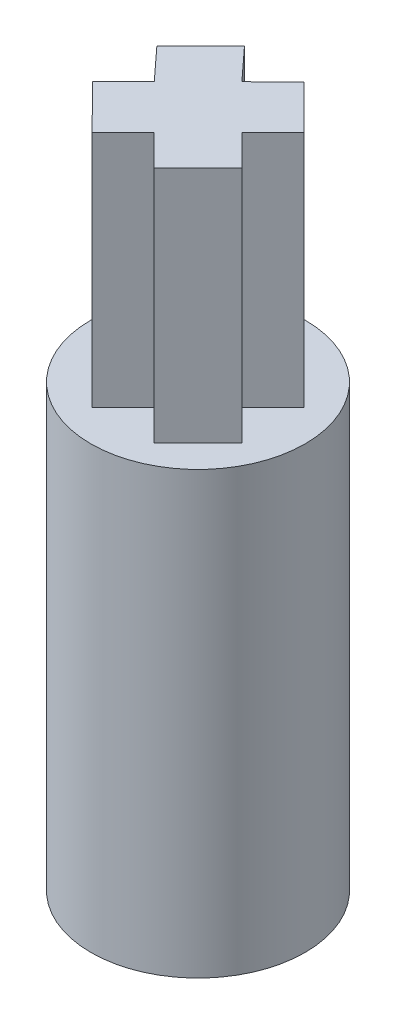
from build123d import *

# Parameters (mm, degrees)
SKETCH1_R           = 5.715
BOSS_EXTRUDE1_DEPTH = 23.495
BOSS_EXTRUDE3_DEPTH = 12.7


with BuildPart() as part:
    # Sketch1 → Boss-Extrude1 (new body)
    with BuildSketch(Plane(origin=(0, 0, 0), x_dir=(1, 0, 0), z_dir=(0, 1, 0))):
        Circle(SKETCH1_R)
    extrude(amount=BOSS_EXTRUDE1_DEPTH)

    # Sketch5 → Boss-Extrude3 (add)
    with BuildSketch(Plane(origin=(0, 23.495, 0), x_dir=(1, 0, 0), z_dir=(0, 1, 0))):
        Polygon((2.685e-06, 2.339735302), (1.655603957, 3.988861939), (3.990936726, 1.650595629), (2.3368, 0), (3.989167126, -1.652367126), (1.652367126, -3.989167126), (0, -2.3368), (-1.653404588, -3.98813026), (-3.988737357, -1.64986395), (-2.3368, 0.002932835), (-3.918102081, 1.723432172), (-1.581302081, 4.060232172), align=None)
    extrude(amount=BOSS_EXTRUDE3_DEPTH)


solid = part.part
